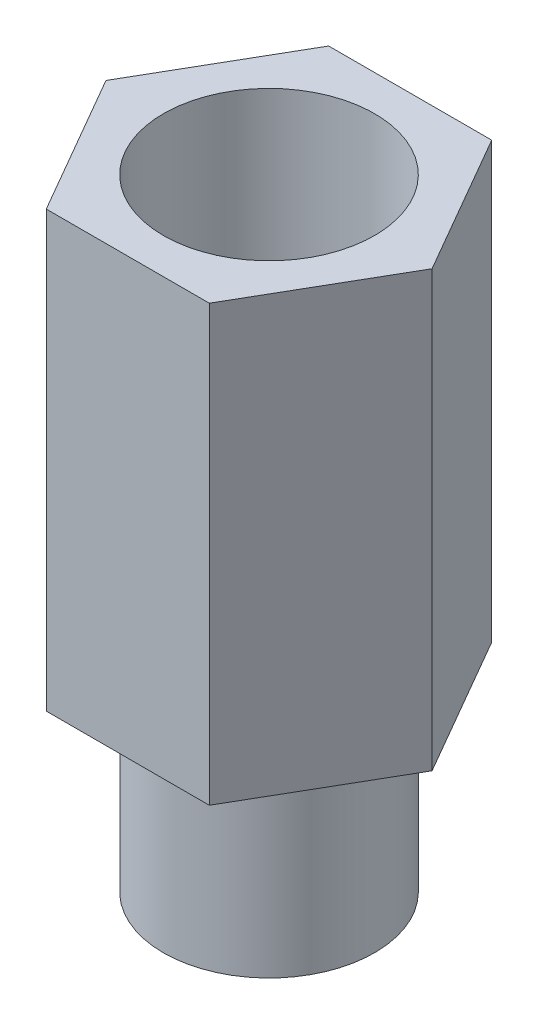
from build123d import *

# Parameters (mm, degrees)
EXTRUDE_1_DEPTH     = 7
SKETCH_2_R          = 1.7
EXTRUDE_2_DEPTH     = 3
SKETCH_3_R          = 1.7
CUT_EXTRUDE_1_DEPTH = 4


with BuildPart() as part:
    # 草图1 → 凸台-拉伸1 (new body)
    with BuildSketch(Plane(origin=(0, 0, 0), x_dir=(1, 0, 0), z_dir=(0, 1, 0))):
        Polygon((1.3125, -2.273316685), (2.625, 0), (1.3125, 2.273316685), (-1.3125, 2.273316685), (-2.625, 0), (-1.3125, -2.273316685), align=None)
    extrude(amount=EXTRUDE_1_DEPTH)

    # 草图2 → 凸台-拉伸2 (add)
    with BuildSketch(Plane(origin=(0, 0, 0), x_dir=(1, 0, 0), z_dir=(0, 1, 0))):
        Circle(SKETCH_2_R)
    extrude(amount=-EXTRUDE_2_DEPTH)

    # 草图3 → 切除-拉伸1 (cut)
    with BuildSketch(Plane(origin=(0, 7, 0), x_dir=(1, 0, 0), z_dir=(0, 1, 0))):
        Circle(SKETCH_3_R)
    extrude(amount=-CUT_EXTRUDE_1_DEPTH, mode=Mode.SUBTRACT)


solid = part.part
